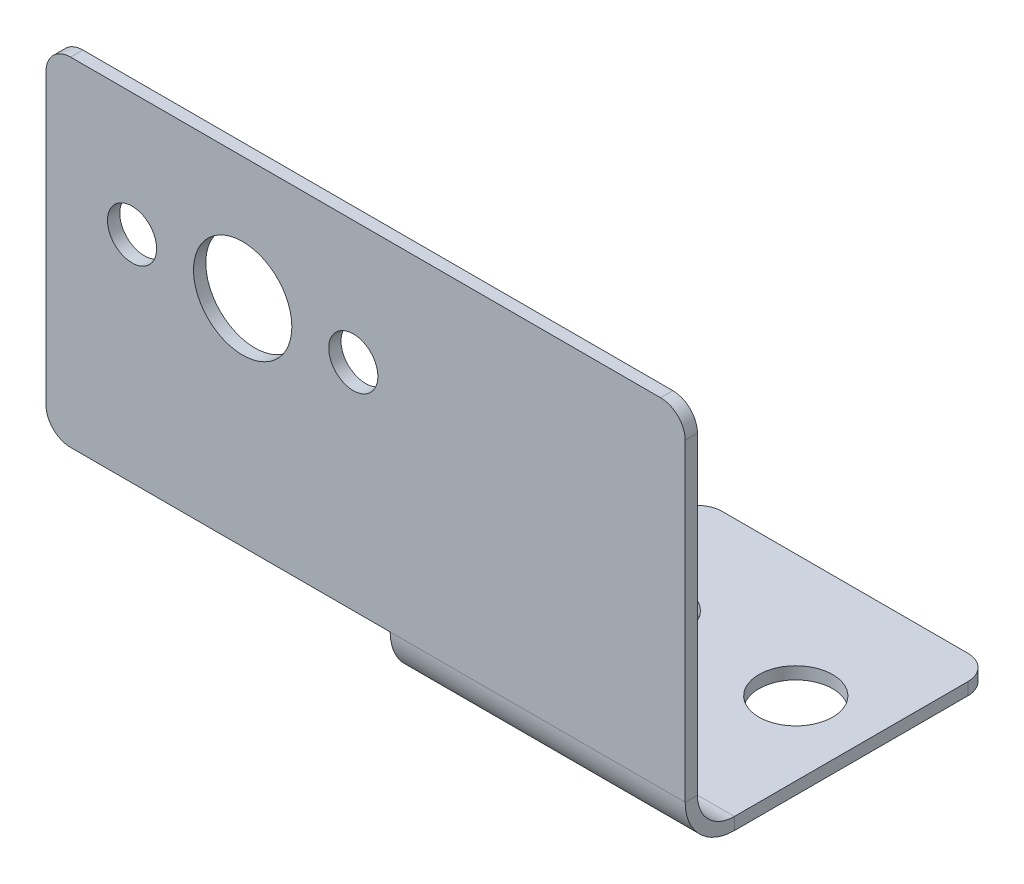
from build123d import *

# Parameters (mm, degrees)
SKETCH1_W              = 12
SKETCH1_H              = 27
BASE_FLANGE1_DEPTH     = 0.5
SKETCHED_START         = -6
SKETCHED_BEND1_DEPTH   = 12
SKETCHED_BEND1_2_DEPTH = 12
TAB1_START             = -0.5
TAB1_OUTLINE_W         = 14
TAB1_OUTLINE_H         = 13.751106428
TAB1_DEPTH             = 0.5
SKETCH8_R              = 1
SKETCH8_R_2            = 2
CUT_EXTRUDE1_DEPTH     = 10
SKETCH9_R              = 1.5
CUT_EXTRUDE2_DEPTH     = 10
FILLET1_R              = 1


# Read off the part's stored shape, not the designer's step: Sketched Bend1, Tab1
# Sheet-metal steps are written as plain solids
with BuildPart() as part:
    # Sketch1 → Base-Flange1 (new body)
    with BuildSketch(Plane(origin=(0, 0, 0), x_dir=(1, 0, 0), z_dir=(0, 1, 0))):
        Rectangle(SKETCH1_W, SKETCH1_H)
    extrude(amount=-BASE_FLANGE1_DEPTH)

    # Sketched Bend1 outline → Sketched Bend1 (cut)
    with BuildSketch(Plane.YZ.offset(SKETCHED_START)):
        with BuildLine():
            ThreePointArc((-0.5, -3), (-0.370828693, -2.292893219), (0, -1.677124345))
            Line((0, -1.677124345), (0, 13.5))
            Line((0, 13.5), (-0.5, 13.5))
            Line((-0.5, 13.5), (-0.5, -3))
        make_face()
    extrude(amount=SKETCHED_BEND1_DEPTH, mode=Mode.SUBTRACT)

    # Sketched Bend1 2 outline → Sketched Bend1 2 (add)
    with BuildSketch(Plane.YZ.offset(SKETCHED_START)):
        with BuildLine():
            ThreePointArc((0, -3), (0.439339828, -1.939339828), (1.5, -1.5))
            Line((1.5, -1.5), (15.251106428, -1.5))
            Line((15.251106428, -1.5), (15.251106428, -1))
            Line((15.251106428, -1), (1.5, -1))
            ThreePointArc((1.5, -1), (0.677124344, -1.177124345), (0, -1.677124345))
            Line((0, -1.677124345), (0, -3))
        make_face()
    extrude(amount=SKETCHED_BEND1_2_DEPTH)

    # Tab1 outline → Tab1 (add)
    with BuildSketch(Plane(origin=(0, 0, -1.5), x_dir=(-1, 0, 0), z_dir=(0, 0, -1)).offset(TAB1_START)):
        with Locations((13, 8.375553214)):
            Rectangle(TAB1_OUTLINE_W, TAB1_OUTLINE_H)
    extrude(amount=TAB1_DEPTH)

    # Sketch8 → Cut-Extrude1 (cut)
    with BuildSketch(Plane.XY.offset(-1)):
        with Locations((-16.5, 10.251106428)):
            Circle(SKETCH8_R)
        with Locations((-7.5, 10.251106428)):
            Circle(SKETCH8_R)
        with Locations((-12, 10.251106428)):
            Circle(SKETCH8_R_2)
    extrude(amount=-CUT_EXTRUDE1_DEPTH, mode=Mode.SUBTRACT)

    # Sketch9 → Cut-Extrude2 (cut)
    with BuildSketch(Plane(origin=(0, 0, 0), x_dir=(1, 0, 0), z_dir=(0, 1, 0))):
        with Locations(Location((-3, 8.5, 0), (0, 0, 270))):
            Circle(SKETCH9_R)
        with Locations(Location((3, 8.5, 0), (0, 0, 270))):
            Circle(SKETCH9_R)
    extrude(amount=-CUT_EXTRUDE2_DEPTH, mode=Mode.SUBTRACT)

    # Fillet1
    fillet1_edges = [part.edges().sort_by_distance(p)[0] for p in [
        (-6, -0.25, -13.5),
        (6, -0.25, -13.5),
        (-20, 15.251106428, -1.25),
        (-20, 1.5, -1.25),
        (6, 15.251106428, -1.25),
    ]]
    fillet(fillet1_edges, radius=FILLET1_R)


solid = part.part
